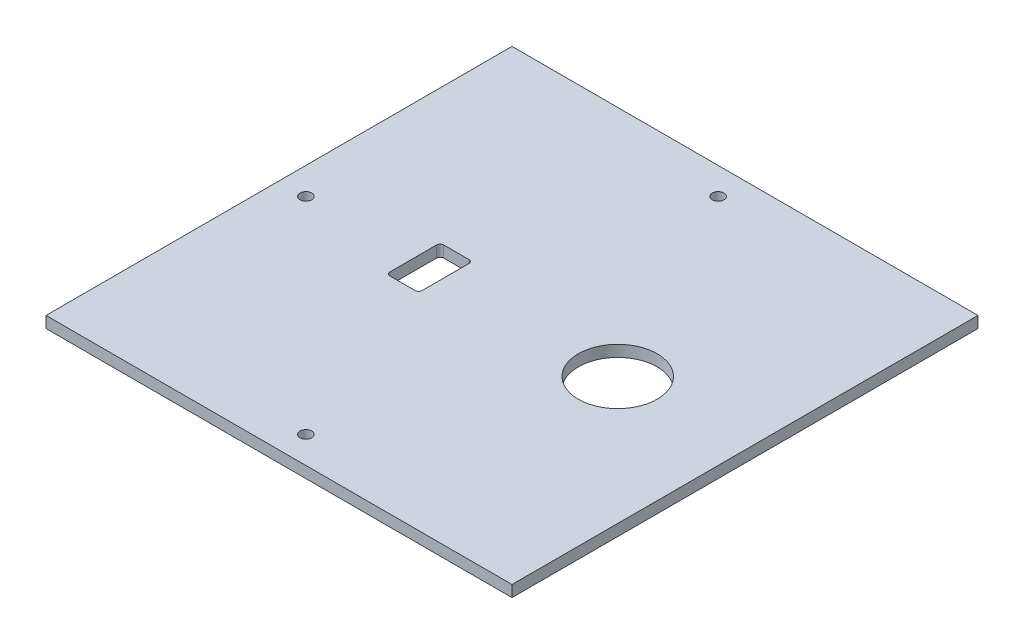
from build123d import *

# Parameters (mm, degrees)
SKETCH1_W           = 130
SKETCH1_H           = 130
SKETCH1_R           = 1.65
SKETCH1_R_2         = 11
BOSS_EXTRUDE1_DEPTH = 3.175


with BuildPart() as part:
    # Sketch1 → Boss-Extrude1 (new body)
    with BuildSketch(Plane(origin=(0, 0, 0), x_dir=(1, 0, 0), z_dir=(0, 1, 0))):
        with Locations((4.465710009, 1.953968968)):
            Rectangle(SKETCH1_W, SKETCH1_H)
        with Locations((-53.034289991, 1.953968968)):
            Circle(SKETCH1_R, mode=Mode.SUBTRACT)
        with Locations((4.465710009, 59.453968968)):
            Circle(SKETCH1_R, mode=Mode.SUBTRACT)
        with Locations((4.465710009, -55.546031032)):
            Circle(SKETCH1_R, mode=Mode.SUBTRACT)
        with Locations((33.965710009, 1.953968968)):
            Circle(SKETCH1_R_2, mode=Mode.SUBTRACT)
        with BuildLine():
            Line((-22.080321023, 9.453968968), (-15.080321023, 9.453968968))
            ThreePointArc((-15.080321023, 9.453968968), (-14.373214242, 9.161075749), (-14.080321023, 8.453968968))
            Line((-14.080321023, 8.453968968), (-14.080321023, -4.546031032))
            ThreePointArc((-14.080321023, -4.546031032), (-14.373214242, -5.253137813), (-15.080321023, -5.546031032))
            Line((-15.080321023, -5.546031032), (-22.080321023, -5.546031032))
            ThreePointArc((-22.080321023, -5.546031032), (-22.787427804, -5.253137813), (-23.080321023, -4.546031032))
            Line((-23.080321023, -4.546031032), (-23.080321023, 8.453968968))
            ThreePointArc((-23.080321023, 8.453968968), (-22.787427804, 9.161075749), (-22.080321023, 9.453968968))
        make_face(mode=Mode.SUBTRACT)
    extrude(amount=BOSS_EXTRUDE1_DEPTH)


solid = part.part
